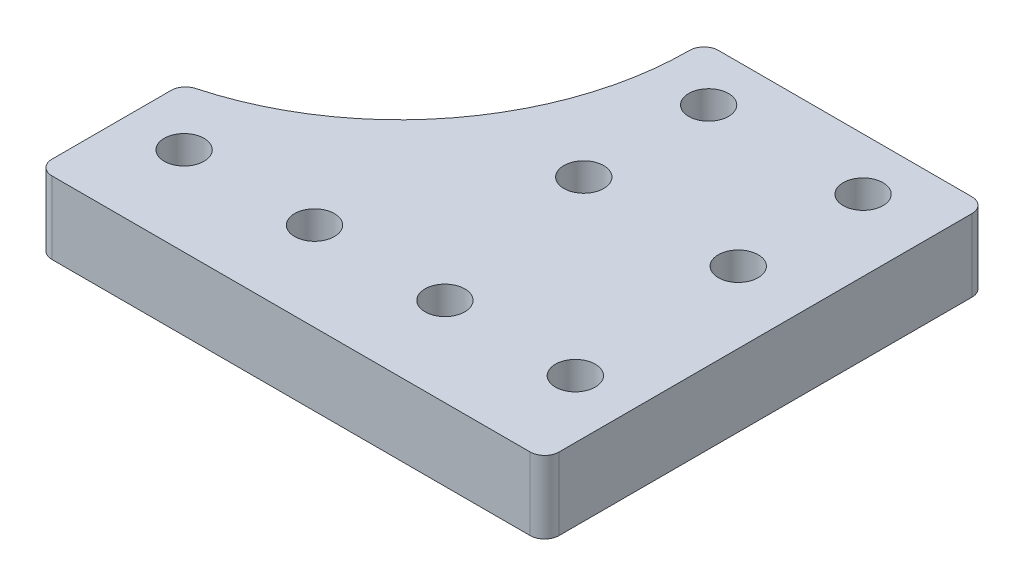
from build123d import *

# Parameters (mm, degrees)
BOSS_EXTRUDE2_DEPTH = 10
FILLET4_R           = 40
FILLET5_R           = 2
FILLET6_R           = 2
FILLET7_R           = 2
SKETCH2_R           = 2.75
CUT_EXTRUDE1_DEPTH  = 94.386294498


with BuildPart() as part:
    # Sketch1 → Boss-Extrude2 (new body)
    with BuildSketch(Plane(origin=(0, 0, 0), x_dir=(1, 0, 0), z_dir=(0, 1, 0))):
        Polygon((-39, 61), (0, 61), (0, 0), (-70, 0), (-70, 20), (-39, 20), align=None)
    extrude(amount=BOSS_EXTRUDE2_DEPTH)

    # Fillet4
    # the kernel refuses this fillet: 40 mm, written as the material it adds along each edge
    with BuildSketch(Plane(origin=(-39, 0, -20), x_dir=(-1, 0, 0), z_dir=(0, 1, 0))) as fillet4_piece_1:
        with BuildLine():
            CenterArc((40, -38.97435054), FILLET4_R, 103.002878163, 76.997121837)
            Line((0, -38.97435054), (-0.8, -38.97435054))
            Line((-0.8, -38.97435054), (-0.8, 0))
            Line((-0.8, 0), (0, 0.8))
            ThreePointArc((0, 0.8), (15.5, 0.8), (30.82, 0.779487011))
            Line((30.82, 0.779487011), (31, 0))
        make_face()
    extrude(amount=10)

    # Fillet5
    fillet5_edges = [part.edges().sort_by_distance(p)[0] for p in [
        (0, 5, -61),
        (0, 5, 0),
        (-70, 5, 0),
    ]]
    fillet(fillet5_edges, radius=FILLET5_R)

    # Fillet6
    fillet6_edges = [part.edges().sort_by_distance(p)[0] for p in [
        (-39, 5, -61),
    ]]
    fillet(fillet6_edges, radius=FILLET6_R)

    # Fillet7
    fillet7_edges = [part.edges().sort_by_distance(p)[0] for p in [
        (-70, 5, -20),
    ]]
    fillet(fillet7_edges, radius=FILLET7_R)

    # Sketch2 → Cut-Extrude1 (cut, through all)
    with BuildSketch(Plane(origin=(0, 10, 0), x_dir=(1, 0, 0), z_dir=(0, 1, 0))):
        with Locations(Location((-9.837865554, 53.798881229, 0), (0, 0, 270))):
            Circle(SKETCH2_R)
        with Locations(Location((-31.15958497, 53.798881229, 0), (0, 0, 270))):
            Circle(SKETCH2_R)
        with Locations(Location((-31.15958497, 36.567952328, 0), (0, 0, 270))):
            Circle(SKETCH2_R)
        with Locations(Location((-9.837865554, 36.567952328, 0), (0, 0, 270))):
            Circle(SKETCH2_R)
        with Locations(Location((-8, 12.241109826, 0), (0, 0, 270))):
            Circle(SKETCH2_R)
        with Locations(Location((-26, 12.241109826, 0), (0, 0, 270))):
            Circle(SKETCH2_R)
        with Locations(Location((-44, 12.241109826, 0), (0, 0, 270))):
            Circle(SKETCH2_R)
        with Locations(Location((-62, 12.241109826, 0), (0, 0, 270))):
            Circle(SKETCH2_R)
    extrude(amount=-CUT_EXTRUDE1_DEPTH, mode=Mode.SUBTRACT)


solid = part.part
